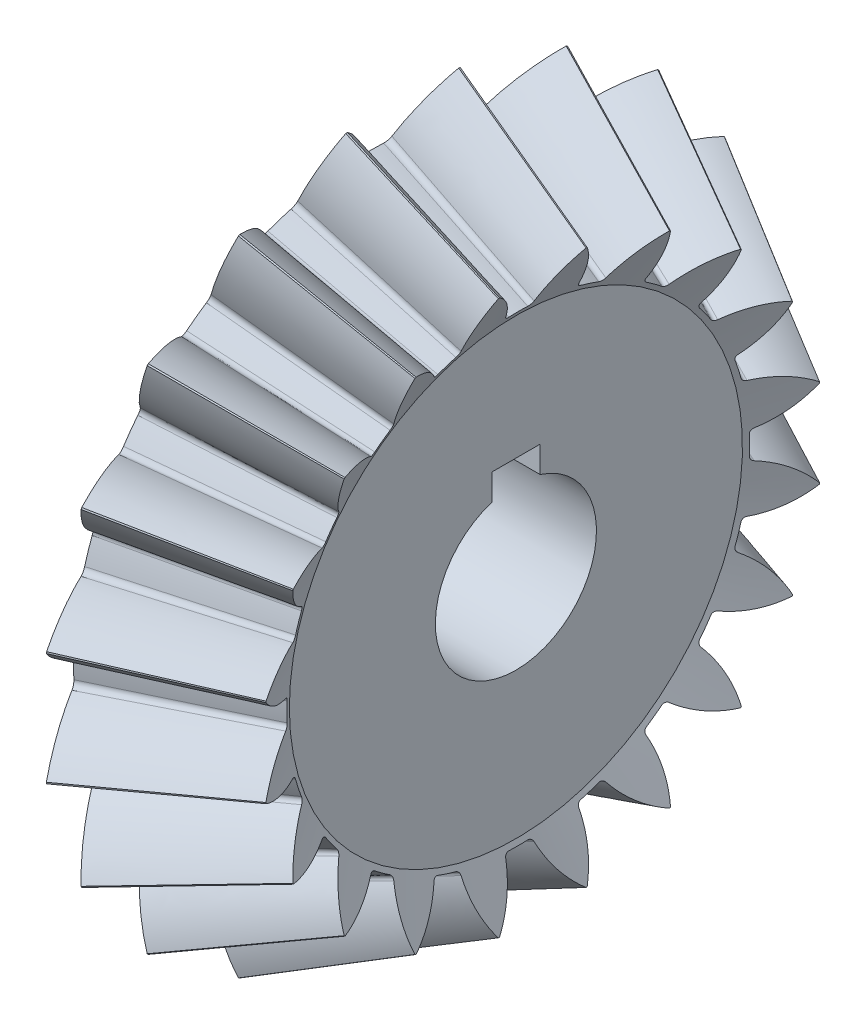
from build123d import *

# Parameters (mm, degrees)
TEETHCUTS_COUNT = 20
TEETHCUTS_ANGLE = 342
HUBSKE_R        = 20
HUB_DEPTH       = 8.114537278
BORSKE_R        = 10
BORE_DEPTH      = 90.0000508
KEYSKE_W        = 6
KEYSKE_H        = 12.8
KEYWAY_DEPTH    = 90.0000508


with BuildPart() as part:
    # BasProSke → Base-Revolve (revolve)
    with BuildSketch(Plane(origin=(0, 0, 0), x_dir=(1, 0, 0), z_dir=(0, 1, 0)), mode=Mode.PRIVATE) as base_revolve_sk:
        Polygon((0, 0), (0, 36.228871357), (4.29157347, 44.812018286), (21.642117284, 34.791746366), (18.310168816, 28.127849438), (18.310168816, 0), align=None)
    revolve(base_revolve_sk.sketch.rotate(Axis((-10, 0, 0), (1, 0, 0)), 180), axis=Axis((-10, 0, 0), (1, 0, 0)))

    # ToothCut: read off the stored shape, not the designer's step
    # ToothCut: loft between two sections, ruled curve by curve
    toothcut_from = [
        Edge.make_bspline([(81.888933635, 0.006738621, -0.010223894), (81.886373247, 0.001617846, -0.014442833), (81.883216481, -0.004695686, -0.013575936), (81.881188729, -0.008751189, -0.008097023)], [0, 0, 0, 0, 1, 1, 1, 1], 3, [1, 0.817810114, 0.817810114, 1]),
        Edge.make_bspline([(81.881188729, -0.008751189, 0.008097023), (81.883216481, -0.004695686, 0.013575936), (81.886373247, 0.001617846, 0.014442833), (81.888933635, 0.006738621, 0.010223894)], [0, 0, 0, 0, 1, 1, 1, 1], 3, [1, 0.817810114, 0.817810114, 1]),
        Edge.make_bspline([(81.881188729, -0.008751189, -0.008097023), (81.880870911, -0.009386825, -0.00723829), (81.880606097, -0.009916453, -0.006293922), (81.880398844, -0.010330959, -0.00528017)], [0, 0, 0, 0, 1, 1, 1, 1], 3, [1, 0.994263946, 0.994263946, 1]),
        Edge.make_bspline([(81.880398844, -0.010330959, 0.00528017), (81.880606097, -0.009916453, 0.006293922), (81.880870911, -0.009386825, 0.00723829), (81.881188729, -0.008751189, 0.008097023)], [0, 0, 0, 0, 1, 1, 1, 1], 3, [1, 0.994263946, 0.994263946, 1]),
        Edge.make_bspline([(81.880398844, -0.010330959, -0.00528017), (81.879702298, -0.011724052, -0.0018731), (81.879702298, -0.011724052, 0.0018731), (81.880398844, -0.010330959, 0.00528017)], [0, 0, 0, 0, 1, 1, 1, 1], 3, [1, 0.939649153, 0.939649153, 1]),
        Edge.make_line((81.888933635, 0.006738621, 0.010223894), (81.888933635, 0.006738621, -0.010223894)),
    ]
    toothcut_to = [
        Edge.make_bspline([(4.40365816, 45.036187664, -7.770946678), (3.430833377, 43.090538102, -5.047579314), (2.123323312, 40.475517975, -3.150013178), (0.614801209, 37.458473774, -2.272245878)], [0, 0, 0, 0, 1, 1, 1, 1], 3, [1, 0.965921678, 0.965921678, 1]),
        Edge.make_bspline([(0.614801209, 37.458473774, 2.272245878), (2.123323312, 40.475517975, 3.150013178), (3.430833377, 43.090538102, 5.047579314), (4.40365816, 45.036187664, 7.770946678)], [0, 0, 0, 0, 1, 1, 1, 1], 3, [1, 0.965921678, 0.965921678, 1]),
        Edge.make_bspline([(0.614801209, 37.458473774, -2.272245878), (0.454744156, 37.138359667, -2.179113104), (0.356313014, 36.941497384, -1.881923658), (0.363142279, 36.955155915, -1.512421532)], [0, 0, 0, 0, 1, 1, 1, 1], 3, [1, 0.852233433, 0.852233433, 1]),
        Edge.make_bspline([(0.363142279, 36.955155915, 1.512421532), (0.356313014, 36.941497384, 1.881923658), (0.454744156, 37.138359667, 2.179113104), (0.614801209, 37.458473774, 2.272245878)], [0, 0, 0, 0, 1, 1, 1, 1], 3, [1, 0.852233433, 0.852233433, 1]),
        Edge.make_bspline([(0.363142279, 36.955155915, -1.512421532), (0.381772376, 36.992416108, -0.504427328), (0.381772376, 36.992416108, 0.504427328), (0.363142279, 36.955155915, 1.512421532)], [0, 0, 0, 0, 1, 1, 1, 1], 3, [1, 0.9994314, 0.9994314, 1]),
        Edge.make_line((4.40365816, 45.036187664, 7.770946678), (4.40365816, 45.036187664, -7.770946678)),
    ]
    toothcut = Solid(Shell([*[Face.make_surface_from_curves(toothcut_from[k], toothcut_to[k]) for k in range(6)], Face(Wire(toothcut_from)), Face(Wire(toothcut_to))]))
    add(toothcut, mode=Mode.SUBTRACT)

    # TeethCuts: ToothCut ×20 about axis
    teethcuts_axis = Axis((-10, 0, 0), (1, 0, 0))
    for i in range(1, TEETHCUTS_COUNT):
        add(toothcut.rotate(teethcuts_axis, i * TEETHCUTS_ANGLE / (TEETHCUTS_COUNT - 1)), mode=Mode.SUBTRACT)

    # HubSke → Hub (add)
    with BuildSketch(Plane.ZY):
        with Locations(Location((0, 0, 0), (0, 0, 180))):
            Circle(HUBSKE_R)
    extrude(amount=HUB_DEPTH)

    # BorSke → Bore (cut, symmetric)
    with BuildSketch(Plane(origin=(0, 0, 0), x_dir=(0, 0, -1), z_dir=(1, 0, 0))):
        with Locations(Location((0, 0, 0), (0, 0, 180))):
            Circle(BORSKE_R)
    extrude(amount=BORE_DEPTH, both=True, mode=Mode.SUBTRACT)

    # KeySke → Keyway (cut, symmetric)
    with BuildSketch(Plane(origin=(0, 0, 0), x_dir=(0, 0, -1), z_dir=(1, 0, 0))):
        with Locations((0, 6.4)):
            Rectangle(KEYSKE_W, KEYSKE_H)
    extrude(amount=KEYWAY_DEPTH, both=True, mode=Mode.SUBTRACT)


solid = part.part
